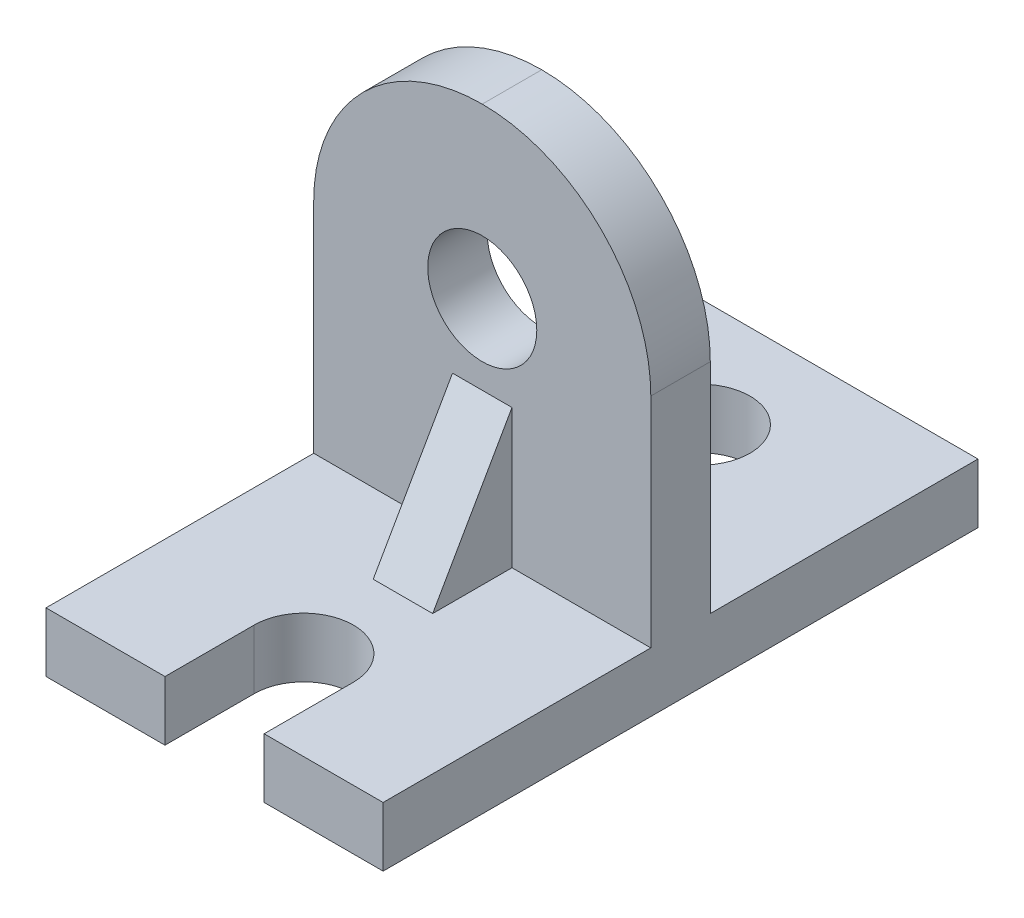
from build123d import *

# Parameters (mm, degrees)
EXTRUDE_1_DEPTH      = 17
EXTRUDE_1_DEPTH_BACK = 17
SKETCH_1_W           = 6
SKETCH_1_H           = 39
FILLET_1_R           = 17
SKETCH_2_R           = 5.5
CUT_EXTRUDE_1_DEPTH  = 46.036096634
EXTRUDE_2_DEPTH      = 3
EXTRUDE_2_DEPTH_BACK = 3
SKETCH_3_R           = 5
CUT_EXTRUDE_2_DEPTH  = 53.057660339


with BuildPart() as part:
    # Эскиз1 → Бобышка-Вытянуть1 (new, two sides: drawn at the far end of the back side and taken through both)
    with BuildSketch(Plane(origin=(0, 0, 0), x_dir=(0, 0, -1), z_dir=(1, 0, 0)).offset(-EXTRUDE_1_DEPTH_BACK)):
        Rectangle(SKETCH_1_W, SKETCH_1_H)
        Polygon((-3, -19.5), (-11, -19.5), (-30, -19.5), (-30, -25.5), (30, -25.5), (30, -19.5), (11, -19.5), (3, -19.5), align=None)
    extrude(amount=EXTRUDE_1_DEPTH + EXTRUDE_1_DEPTH_BACK)

    # Скругление1
    fillet_1_edges = [part.edges().sort_by_distance(p)[0] for p in [
        (17, 19.5, 0),
        (-17, 19.5, 0),
    ]]
    fillet(fillet_1_edges, radius=FILLET_1_R - 0.0001)  # a hair under: the kernel refuses the full size

    # Эскиз2 → Вырез-Вытянуть1 (cut, through all)
    with BuildSketch(Plane.XY.offset(3)):
        with Locations((0, 2.5)):
            Circle(SKETCH_2_R)
    extrude(amount=-CUT_EXTRUDE_1_DEPTH, mode=Mode.SUBTRACT)

    # Эскиз1<3> → Бобышка-Вытянуть2 (add, two sides: drawn at the far end of the back side and taken through both)
    with BuildSketch(Plane(origin=(0, 0, 0), x_dir=(0, 0, -1), z_dir=(1, 0, 0)).offset(-EXTRUDE_2_DEPTH_BACK)):
        Polygon((-3, -5.5), (-11, -19.5), (-3, -19.5), align=None)
        Polygon((3, -5.5), (3, -19.5), (11, -19.5), align=None)
    extrude(amount=EXTRUDE_2_DEPTH + EXTRUDE_2_DEPTH_BACK)

    # Эскиз3 → Вырез-Вытянуть2 (cut, through all)
    with BuildSketch(Plane(origin=(0, -19.5, 0), x_dir=(1, 0, 0), z_dir=(0, 1, 0))):
        with Locations(Location((0, 19, 0), (0, 0, 270))):
            Circle(SKETCH_3_R)
        with Locations((0, -21)):
            Circle(SKETCH_3_R)
        with BuildLine():
            ThreePointArc((5, -21), (0, -26), (-5, -21))
            Line((-5, -21), (-5, -30))
            Line((-5, -30), (5, -30))
            Line((5, -30), (5, -21))
        make_face()
    extrude(amount=-CUT_EXTRUDE_2_DEPTH, mode=Mode.SUBTRACT)


solid = part.part
